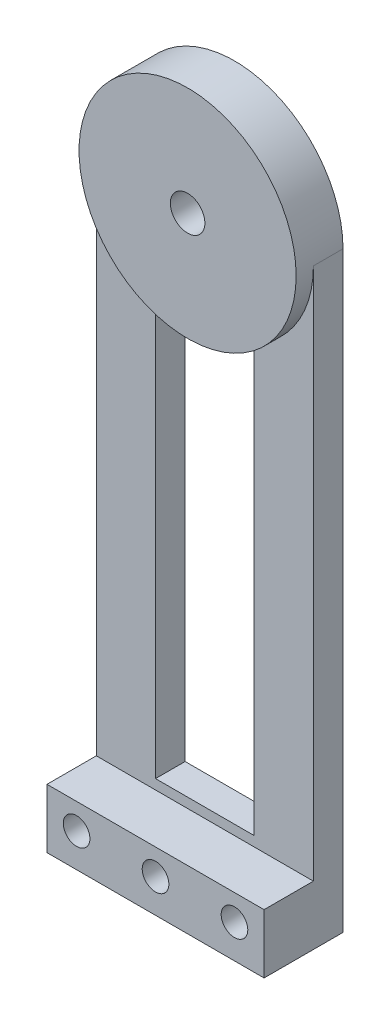
from build123d import *
from build123d.topology import SkipClean

# Parameters (mm, degrees)
BOSS_EXTRUDE1_DEPTH           = 3
BOSS_EXTRUDE2_START           = -1.75
SKETCH1_3_R                   = 11
BOSS_EXTRUDE2_DEPTH           = 1.75
SKETCH2_R                     = 1.75
CUT_EXTRUDE1_DEPTH            = 4.75
SKETCH2_3_R                   = 3
CUT_EXTRUDE2_DEPTH            = 1.75
SKETCH1_6_W                   = 11
SKETCH1_6_H                   = 6
BOSS_EXTRUDE3_DEPTH           = 5
SKETCH3_R                     = 1.35
CUT_EXTRUDE3_DEPTH            = 8
LPATTERN1_COUNT               = 2
LPATTERN1_PITCH               = 8
LPATTERN1_COL_COUNT           = 2
LPATTERN1_COL_PITCH           = 8
BODY_MOVE_COPY1_START         = -3
BODY_MOVE_COPY1_OUTLINE_R     = 3
BODY_MOVE_COPY1_DEPTH         = 3
BODY_MOVE_COPY1_START_2       = 3
BODY_MOVE_COPY1_2_OUTLINE_W   = 22
BODY_MOVE_COPY1_2_OUTLINE_H   = 6
BODY_MOVE_COPY1_2_OUTLINE_R   = 1.35
BODY_MOVE_COPY1_2_DEPTH       = 2
BODY_MOVE_COPY1_START_3       = 1.25
BODY_MOVE_COPY1_3_OUTLINE_R   = 3
BODY_MOVE_COPY1_3_OUTLINE_R_2 = 1.75
BODY_MOVE_COPY1_3_DEPTH       = 0.5
BODY_MOVE_COPY1_4_DEPTH       = 3
BODY_MOVE_COPY1_START_4       = 1.75
BODY_MOVE_COPY1_5_OUTLINE_R   = 11
BODY_MOVE_COPY1_5_OUTLINE_R_2 = 3
BODY_MOVE_COPY1_5_DEPTH       = 1.25
BODY_MOVE_COPY1_START_5       = -5
BODY_MOVE_COPY1_6_OUTLINE_W   = 22
BODY_MOVE_COPY1_6_OUTLINE_H   = 6
BODY_MOVE_COPY1_6_OUTLINE_R   = 1.35
BODY_MOVE_COPY1_6_DEPTH       = 2
BODY_MOVE_COPY1_START_6       = -1.75
BODY_MOVE_COPY1_7_OUTLINE_R   = 3
BODY_MOVE_COPY1_7_OUTLINE_R_2 = 1.75
BODY_MOVE_COPY1_7_DEPTH       = 0.5


# Read off the part's stored shape, not the designer's step: Body-Move/Copy1
with BuildPart() as part:
    # Sketch1 → Boss-Extrude1 (new body)
    with BuildSketch(Plane.XY):
        with BuildLine():
            Line((-11, 30), (-11, -30))
            Line((-11, -30), (11, -30))
            Line((11, -30), (11, 30))
            ThreePointArc((11, 30), (0, 41), (-11, 30))
        make_face()
        with BuildLine():
            Line((5, -23), (-5, -23))
            Line((-5, -23), (-5, 19.643842411))
            ThreePointArc((-5, 19.643842411), (0, 18.5), (5, 19.643842411))
            Line((5, 19.643842411), (5, -23))
        make_face(mode=Mode.SUBTRACT)
    extrude(amount=BOSS_EXTRUDE1_DEPTH)

    # Sketch1<3> → Boss-Extrude2 (add)
    with BuildSketch(Plane.XY.offset(BOSS_EXTRUDE2_START)):
        with Locations((0, 30)):
            Circle(SKETCH1_3_R)
    extrude(amount=BOSS_EXTRUDE2_DEPTH)

    # Sketch2 → Cut-Extrude1 (cut)
    with BuildSketch(Plane.XY.offset(3)):
        with Locations((0, 30)):
            Circle(SKETCH2_R)
    extrude(amount=-CUT_EXTRUDE1_DEPTH, mode=Mode.SUBTRACT)

    # Sketch2<3> → Cut-Extrude2 (cut)
    with BuildSketch(Plane.XY.offset(3)):
        with Locations((0, 30)):
            Circle(SKETCH2_3_R)
    extrude(amount=-CUT_EXTRUDE2_DEPTH, mode=Mode.SUBTRACT)

    # Sketch1<6> → Boss-Extrude3 (add)
    with BuildSketch(Plane.XY):
        with Locations((5.5, -27)):
            Rectangle(SKETCH1_6_W, SKETCH1_6_H)
        with Locations((-5.5, -27)):
            Rectangle(SKETCH1_6_W, SKETCH1_6_H)
    extrude(amount=-BOSS_EXTRUDE3_DEPTH)

    # Sketch3 → Cut-Extrude3 (cut)
    with BuildSketch(Plane.XY.offset(3)):
        with Locations((0, -26.6)):
            Circle(SKETCH3_R)
    cut_extrude3 = extrude(amount=-CUT_EXTRUDE3_DEPTH, mode=Mode.SUBTRACT)

    # LPattern1: Cut-Extrude3 ×2
    with Locations(*[(i * LPATTERN1_PITCH, 0, 0) for i in range(1, LPATTERN1_COUNT)]):
        add(cut_extrude3, mode=Mode.SUBTRACT)

    # LPattern1 col: Cut-Extrude3 ×2
    with Locations(*[(-i * LPATTERN1_COL_PITCH, 0, 0) for i in range(1, LPATTERN1_COL_COUNT)]):
        add(cut_extrude3, mode=Mode.SUBTRACT)

    # Body-Move/Copy1 outline → Body-Move/Copy1 (add)
    with BuildSketch(Plane.XY.offset(BODY_MOVE_COPY1_START)):
        with BuildLine():
            Line((-11, 30), (-11, -24))
            Line((-11, -24), (11, -24))
            Line((11, -24), (11, 30))
            ThreePointArc((11, 30), (0, 41), (-11, 30))
        make_face()
        with BuildLine():
            Line((-5, -23), (-5, 19.643842411))
            ThreePointArc((-5, 19.643842411), (0, 18.5), (5, 19.643842411))
            Line((5, 19.643842411), (5, -23))
            Line((5, -23), (-5, -23))
        make_face(mode=Mode.SUBTRACT)
        with Locations((0, 30)):
            Circle(BODY_MOVE_COPY1_OUTLINE_R, mode=Mode.SUBTRACT)
    extrude(amount=BODY_MOVE_COPY1_DEPTH)

    # Body-Move_Copy1 2 outline → Body-Move_Copy1 2 (add)
    with BuildSketch(Plane.XY.offset(BODY_MOVE_COPY1_START_2)):
        with Locations((0, -27)):
            Rectangle(BODY_MOVE_COPY1_2_OUTLINE_W, BODY_MOVE_COPY1_2_OUTLINE_H)
        with Locations((-8, -26.6)):
            Circle(BODY_MOVE_COPY1_2_OUTLINE_R, mode=Mode.SUBTRACT)
        with Locations((0, -26.6)):
            Circle(BODY_MOVE_COPY1_2_OUTLINE_R, mode=Mode.SUBTRACT)
        with Locations((8, -26.6)):
            Circle(BODY_MOVE_COPY1_2_OUTLINE_R, mode=Mode.SUBTRACT)
    extrude(amount=BODY_MOVE_COPY1_2_DEPTH)

    # Body-Move_Copy1 3 outline → Body-Move_Copy1 3 (add)
    with BuildSketch(Plane.XY.offset(BODY_MOVE_COPY1_START_3)):
        with Locations((0, 30)):
            Circle(BODY_MOVE_COPY1_3_OUTLINE_R)
        with Locations((0, 30)):
            Circle(BODY_MOVE_COPY1_3_OUTLINE_R_2, mode=Mode.SUBTRACT)
    extrude(amount=BODY_MOVE_COPY1_3_DEPTH)

    # Body-Move_Copy1 4 outline → Body-Move_Copy1 4 (cut)
    with SkipClean():  # the faces are left unmerged after this step: merging them gives an invalid solid
        with BuildSketch(Plane.XY):
            with BuildLine():
                Line((-11, 30), (-11, -24))
                Line((-11, -24), (11, -24))
                Line((11, -24), (11, 30))
                ThreePointArc((11, 30), (0, 19), (-11, 30))
            make_face()
            with BuildLine():
                Line((-5, -23), (-5, 19.643842411))
                ThreePointArc((-5, 19.643842411), (0, 18.5), (5, 19.643842411))
                Line((5, 19.643842411), (5, -23))
                Line((5, -23), (-5, -23))
            make_face(mode=Mode.SUBTRACT)
        extrude(amount=BODY_MOVE_COPY1_4_DEPTH, mode=Mode.SUBTRACT)

    # Body-Move_Copy1 5 outline → Body-Move_Copy1 5 (cut)
    with BuildSketch(Plane.XY.offset(BODY_MOVE_COPY1_START_4)):
        with Locations((0, 30)):
            Circle(BODY_MOVE_COPY1_5_OUTLINE_R)
        with Locations((0, 30)):
            Circle(BODY_MOVE_COPY1_5_OUTLINE_R_2, mode=Mode.SUBTRACT)
    extrude(amount=BODY_MOVE_COPY1_5_DEPTH, mode=Mode.SUBTRACT)

    # Body-Move_Copy1 6 outline → Body-Move_Copy1 6 (cut)
    with BuildSketch(Plane.XY.offset(BODY_MOVE_COPY1_START_5)):
        with Locations((0, -27)):
            Rectangle(BODY_MOVE_COPY1_6_OUTLINE_W, BODY_MOVE_COPY1_6_OUTLINE_H)
        with Locations((-8, -26.6)):
            Circle(BODY_MOVE_COPY1_6_OUTLINE_R, mode=Mode.SUBTRACT)
        with Locations((0, -26.6)):
            Circle(BODY_MOVE_COPY1_6_OUTLINE_R, mode=Mode.SUBTRACT)
        with Locations((8, -26.6)):
            Circle(BODY_MOVE_COPY1_6_OUTLINE_R, mode=Mode.SUBTRACT)
    extrude(amount=BODY_MOVE_COPY1_6_DEPTH, mode=Mode.SUBTRACT)

    # Body-Move_Copy1 7 outline → Body-Move_Copy1 7 (cut)
    with BuildSketch(Plane.XY.offset(BODY_MOVE_COPY1_START_6)):
        with Locations((0, 30)):
            Circle(BODY_MOVE_COPY1_7_OUTLINE_R)
        with Locations((0, 30)):
            Circle(BODY_MOVE_COPY1_7_OUTLINE_R_2, mode=Mode.SUBTRACT)
    extrude(amount=BODY_MOVE_COPY1_7_DEPTH, mode=Mode.SUBTRACT)


solid = part.part
